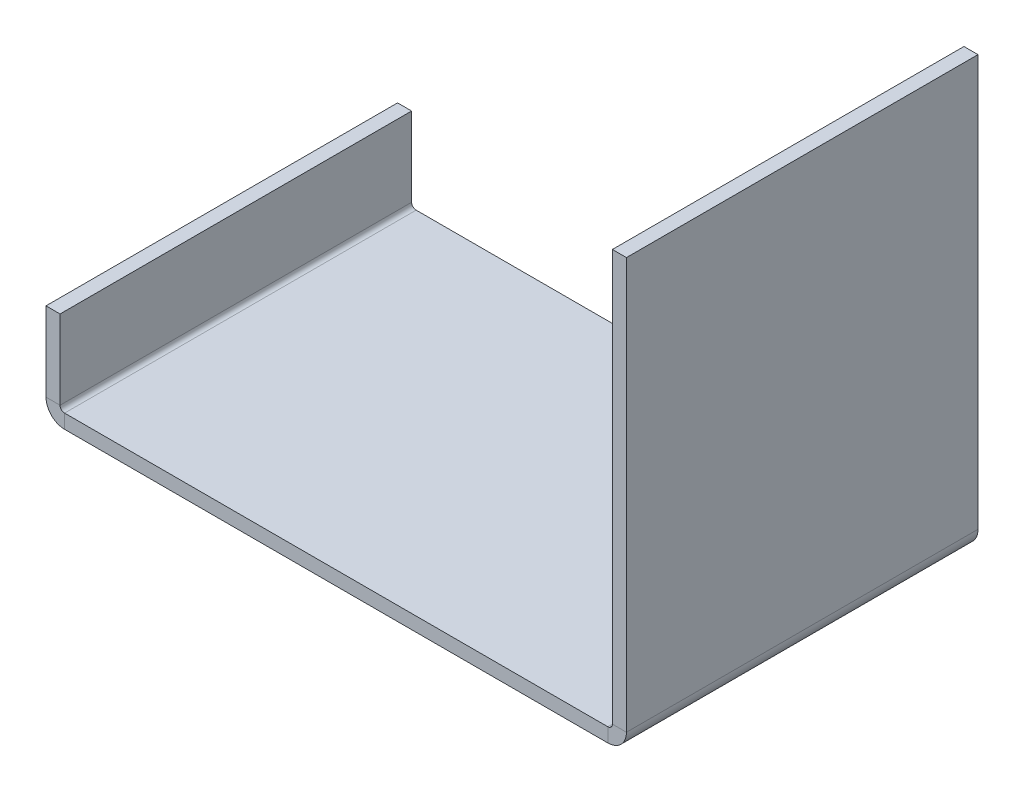
from build123d import *

# Parameters (mm, degrees)
SKETCH1_W                    = 94.361
SKETCH1_H                    = 57.15
BASE_FLANGE1_DEPTH           = 2.286
EDGE_FLANGE1_STRIP_W         = 10.6172
EDGE_FLANGE1_STRIP_H         = 2.286
EDGE_FLANGE1_STRIP_CUT_DEPTH = 57.15
EDGE_FLANGE1_DEPTH           = 57.15
EDGE_FLANGE2_STRIP_W         = 10.6172
EDGE_FLANGE2_STRIP_H         = 2.286
EDGE_FLANGE2_STRIP_CUT_DEPTH = 57.15
EDGE_FLANGE2_DEPTH           = 57.15


# Sheet-metal steps are written as plain solids
with BuildPart() as part:
    # Sketch1 → Base-Flange1 (new body)
    with BuildSketch(Plane(origin=(0, 0, 0), x_dir=(1, 0, 0), z_dir=(0, 1, 0))):
        Rectangle(SKETCH1_W, SKETCH1_H)
    extrude(amount=-BASE_FLANGE1_DEPTH)

    # Edge-Flange1 strip (across the edge) → Edge-Flange1 strip cut (cut)
    with BuildSketch(Plane(origin=(-47.1805, 0, -28.575), x_dir=(1, 0, 0), z_dir=(0, 0, 1))):
        with Locations((-2.286, -1.143)):
            Rectangle(EDGE_FLANGE1_STRIP_W, EDGE_FLANGE1_STRIP_H)
    extrude(amount=EDGE_FLANGE1_STRIP_CUT_DEPTH, mode=Mode.SUBTRACT)

    # Edge-Flange1 section (across the edge) → Edge-Flange1 (add)
    with BuildSketch(Plane(origin=(-47.1805, 0, -28.575), x_dir=(1, 0, 0), z_dir=(0, 0, 1))):
        with BuildLine():
            Line((0, 0.7366), (0, 13.589))
            Line((0, 13.589), (2.286, 13.589))
            Line((2.286, 13.589), (2.286, 0.7366))
            ThreePointArc((2.286, 0.7366), (2.501745145, 0.215745145), (3.0226, 0))
            Line((3.0226, 0), (3.0226, -2.286))
            ThreePointArc((3.0226, -2.286), (0.885299043, -1.400700957), (0, 0.7366))
        make_face()
    extrude(amount=EDGE_FLANGE1_DEPTH)

    # Edge-Flange2 strip (across the edge) → Edge-Flange2 strip cut (cut)
    with BuildSketch(Plane(origin=(47.1805, 0, 28.575), x_dir=(-1, 0, 0), z_dir=(0, 0, -1))):
        with Locations((-2.286, -1.143)):
            Rectangle(EDGE_FLANGE2_STRIP_W, EDGE_FLANGE2_STRIP_H)
    extrude(amount=EDGE_FLANGE2_STRIP_CUT_DEPTH, mode=Mode.SUBTRACT)

    # Edge-Flange2 section (across the edge) → Edge-Flange2 (add)
    with BuildSketch(Plane(origin=(47.1805, 0, 28.575), x_dir=(-1, 0, 0), z_dir=(0, 0, -1))):
        with BuildLine():
            Line((0, 0.7366), (0, 67.564))
            Line((0, 67.564), (2.286, 67.564))
            Line((2.286, 67.564), (2.286, 0.7366))
            ThreePointArc((2.286, 0.7366), (2.501745145, 0.215745145), (3.0226, 0))
            Line((3.0226, 0), (3.0226, -2.286))
            ThreePointArc((3.0226, -2.286), (0.885299043, -1.400700957), (0, 0.7366))
        make_face()
    extrude(amount=EDGE_FLANGE2_DEPTH)


solid = part.part
